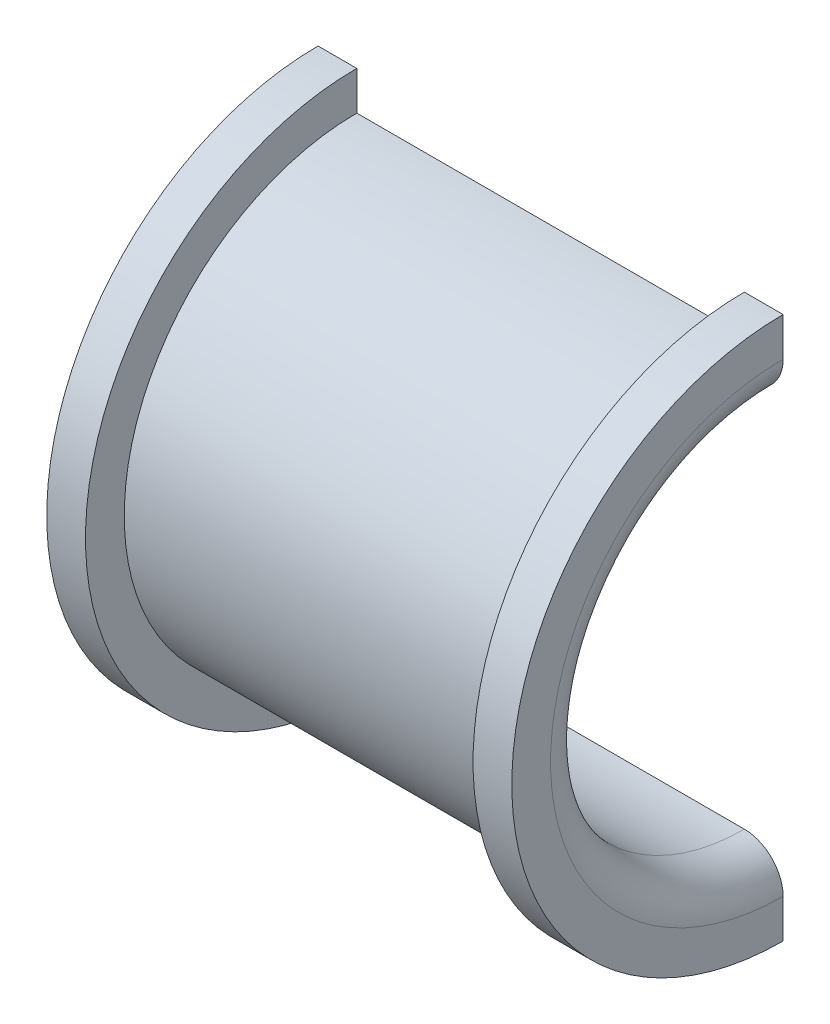
from build123d import *

# Parameters (mm, degrees)
SKETCH1_R               = 30
SKETCH1_R_2             = 25
BOSS_EXTRUDE1_DEPTH     = 25
SKETCH2_R               = 35
SKETCH2_R_2             = 25
BOSS_EXTRUDE2_DEPTH     = 5
FILLET1_R               = 5
CUT_EXTRUDE1_DEPTH      = 78.781745931
CUT_EXTRUDE1_DEPTH_BACK = 78.781745931
SKETCH3_W               = 61.025724242
SKETCH3_H               = 108.223839892


with BuildPart() as part:
    # Sketch1 → Boss-Extrude1 (new, symmetric)
    with BuildSketch(Plane(origin=(0, 0, 0), x_dir=(0, 0, -1), z_dir=(1, 0, 0))):
        Circle(SKETCH1_R)
        Circle(SKETCH1_R_2, mode=Mode.SUBTRACT)
    extrude(amount=BOSS_EXTRUDE1_DEPTH, both=True)

    # Sketch2 → Boss-Extrude2 (add)
    with BuildSketch(Plane(origin=(25, 0, 0), x_dir=(0, 0, -1), z_dir=(1, 0, 0))):
        Circle(SKETCH2_R)
        Circle(SKETCH2_R_2, mode=Mode.SUBTRACT)
    boss_extrude2 = extrude(amount=BOSS_EXTRUDE2_DEPTH)

    # Mirror3: Boss-Extrude2 across plane
    add(boss_extrude2.mirror(Plane(origin=(0, 0, 0), x_dir=(0, 0, 1), z_dir=(1, 0, 0))))

    # Fillet1
    fillet1_edges = [part.edges().sort_by_distance(p)[0] for p in [
        (30, 0, 25),
        (-30, 0, 25),
    ]]
    fillet(fillet1_edges, radius=FILLET1_R - 0.0001)  # a hair under: the kernel refuses the full size

    # Sketch3 → Cut-Extrude1 (cut, two sides: drawn at the far end of the back side and taken through both)
    with BuildSketch(Plane(origin=(30, 0, 0), x_dir=(0, 0, -1), z_dir=(1, 0, 0)).offset(-CUT_EXTRUDE1_DEPTH_BACK)):
        with Locations((30.512862121, 2.693719616)):
            Rectangle(SKETCH3_W, SKETCH3_H)
    extrude(amount=CUT_EXTRUDE1_DEPTH + CUT_EXTRUDE1_DEPTH_BACK, mode=Mode.SUBTRACT)


solid = part.part
